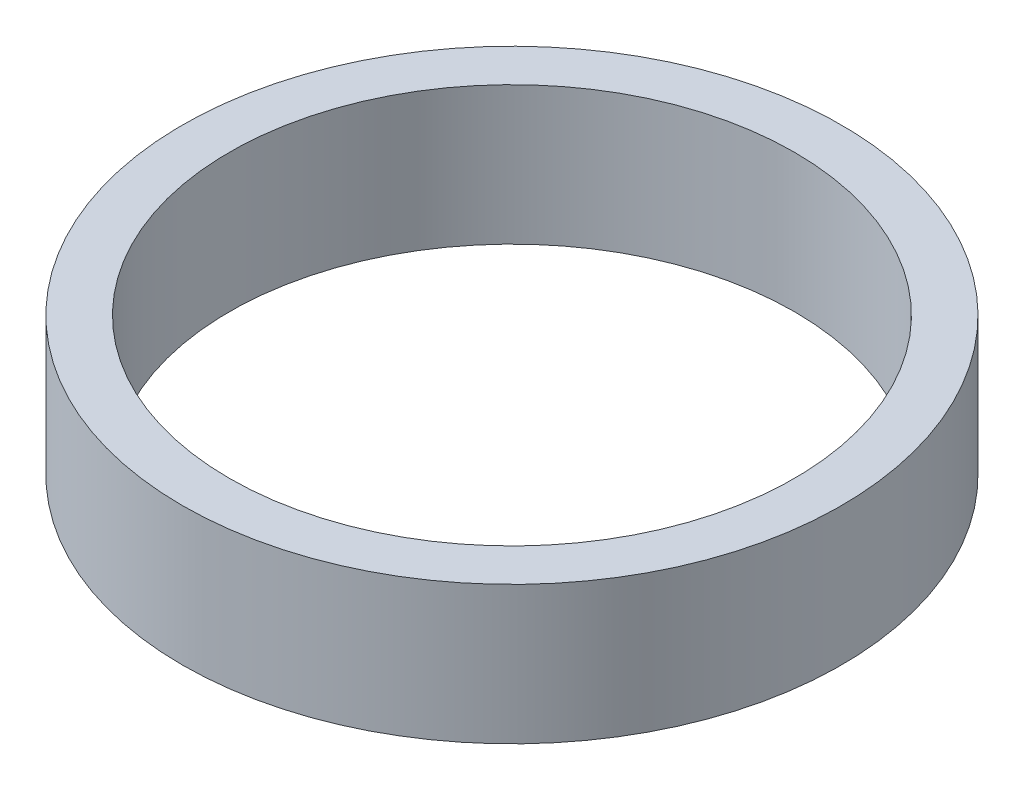
from build123d import *

# Parameters (mm, degrees)
SKETCH1_R           = 52.5
BOSS_EXTRUDE1_DEPTH = 22
SKETCH2_R           = 45
CUT_EXTRUDE1_DEPTH  = 78.437071226


with BuildPart() as part:
    # Sketch1 → Boss-Extrude1 (new body)
    with BuildSketch(Plane(origin=(0, 0, 0), x_dir=(1, 0, 0), z_dir=(0, 1, 0))):
        Circle(SKETCH1_R)
    extrude(amount=BOSS_EXTRUDE1_DEPTH)

    # Sketch2 → Cut-Extrude1 (cut, through all)
    with BuildSketch(Plane(origin=(0, 0, 0), x_dir=(1, 0, 0), z_dir=(0, 1, 0))):
        Circle(SKETCH2_R)
    extrude(amount=CUT_EXTRUDE1_DEPTH, mode=Mode.SUBTRACT)


solid = part.part
